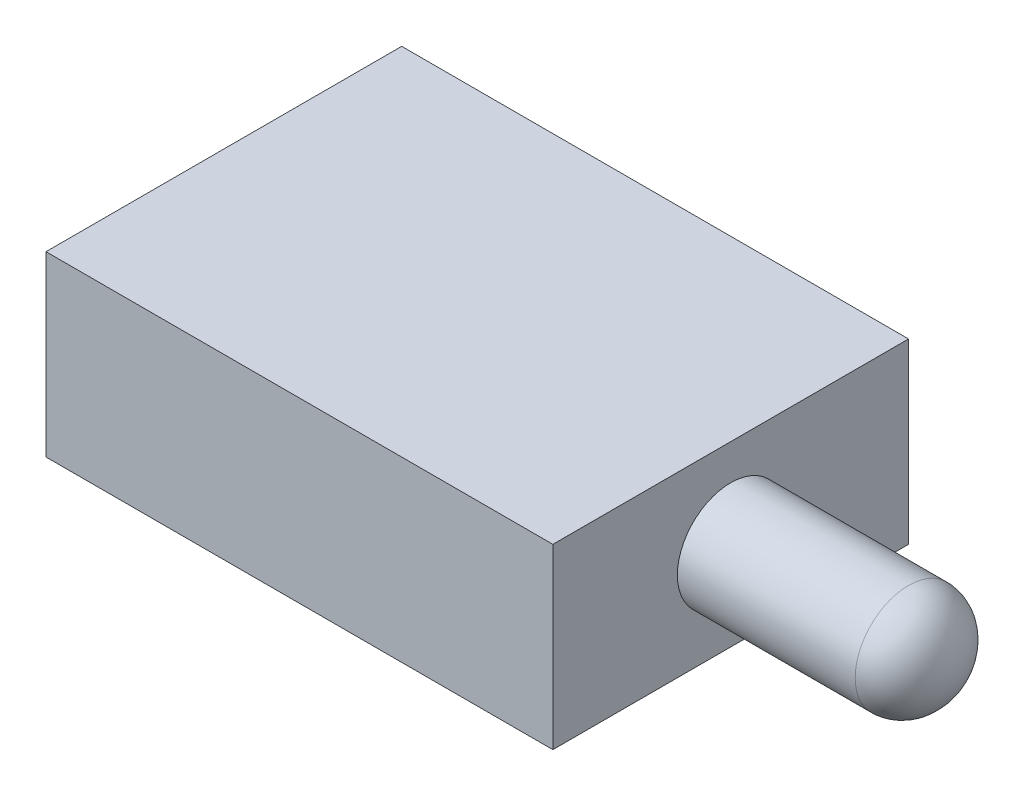
from build123d import *

# Parameters (mm, degrees)
SKETCH1_W           = 5.7
SKETCH1_H           = 4
BOSS_EXTRUDE1_DEPTH = 2
SKETCH2_R           = 0.6
BOSS_EXTRUDE2_DEPTH = 2
SKETCH3_R           = 0.4
BOSS_EXTRUDE3_DEPTH = 0.6


# Read off the part's stored shape, not the designer's step: Dome1
with BuildPart() as part:
    # Sketch1 → Boss-Extrude1 (new body)
    with BuildSketch(Plane(origin=(0, 0, 0), x_dir=(1, 0, 0), z_dir=(0, 1, 0))):
        with Locations((2.85, 0)):
            Rectangle(SKETCH1_W, SKETCH1_H)
    extrude(amount=BOSS_EXTRUDE1_DEPTH)

    # Sketch2 → Boss-Extrude2 (add)
    with BuildSketch(Plane(origin=(5.7, 0, 0), x_dir=(0, 0, -1), z_dir=(1, 0, 0))):
        with Locations(Location((0, 1, 0), (0, 0, 180))):
            Circle(SKETCH2_R)
    extrude(amount=BOSS_EXTRUDE2_DEPTH)

    # Dome1 outline → Dome1 (revolve)
    with BuildSketch(Plane(origin=(0, 1, 0), x_dir=(0, 1, 0), z_dir=(0, 0, -1))):
        with BuildLine():
            add(Edge.make_bspline(
                [(0, 8.2), (0.6, 8.2), (0.6, 7.7)],
                knots=[4.71238898, 4.71238898, 4.71238898, 6.283185307, 6.283185307, 6.283185307], degree=2, weights=[1, 0.707106781, 1]))
            Line((0, 8.2), (0, 7.7))
            Line((0, 7.7), (0.6, 7.7))
        make_face()
    revolve(axis=Axis((0, 1, 0), (1, 0, 0)))

    # Sketch3 → Boss-Extrude3 (add)
    with BuildSketch(Plane(origin=(0, 0, 0), x_dir=(-1, 0, 0), z_dir=(0, -1, 0))):
        with Locations(Location((-4.45, 0, 0), (0, 0, 90))):
            Circle(SKETCH3_R)
        with Locations(Location((-1.45, 0, 0), (0, 0, 90))):
            Circle(SKETCH3_R)
    extrude(amount=BOSS_EXTRUDE3_DEPTH)


solid = part.part
